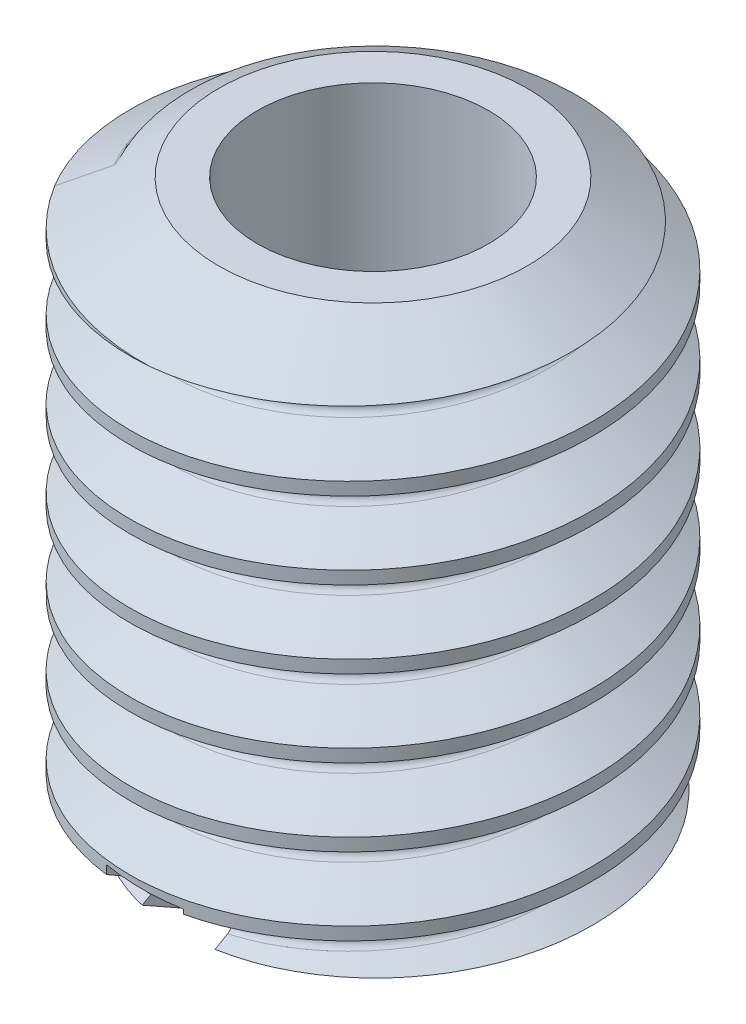
from build123d import *

# Parameters (mm, degrees)
SKETCH1_R           = 3
BOSS_EXTRUDE1_DEPTH = 7.5
CUT_SWEEP1_PITCH    = 1
SKETCH5_R           = 1.5
CUT_EXTRUDE2_DEPTH  = 9.616844126
SKETCH6_W           = 1
SKETCH6_H           = 6
CUT_EXTRUDE4_DEPTH  = 1


with BuildPart() as part:
    # Sketch1 → Boss-Extrude1 (new body)
    with BuildSketch(Plane(origin=(0, 0, 0), x_dir=(1, 0, 0), z_dir=(0, 1, 0))):
        with Locations(Location((0, 0, 0), (0, 0, 270))):
            Circle(SKETCH1_R)
    extrude(amount=BOSS_EXTRUDE1_DEPTH)

    # Cut-Sweep1: the profile of Sketch3 profile screwed along a right-hand helix of 9 turns, 8 arcs to a turn; built about Z, then put on its axis
    cut_sweep1_z = Axis((0, 0, 0), (0, 0, 1))
    cut_sweep1_corners = [(2.440626588, 0, -0.09375), (3.0003, 0, -0.416877595), (3.0003, 0, 0.416877595), (2.440626588, 0, 0.09375), (2.3865, 0, 0)]
    with BuildLine(mode=Mode.PRIVATE) as cut_sweep1_profile:
        Line(cut_sweep1_corners[0], cut_sweep1_corners[1])
        Line(cut_sweep1_corners[1], cut_sweep1_corners[2])
        Line(cut_sweep1_corners[2], cut_sweep1_corners[3])
        ThreePointArc((2.440626588, 0, 0.09375), (2.401003175, 0, 0.054126588), (2.3865, 0, 0))
        ThreePointArc((2.3865, 0, 0), (2.401003175, 0, -0.054126588), (2.440626588, 0, -0.09375))
    cut_sweep1_cap = Face(cut_sweep1_profile.wire())
    cut_sweep1_arcs = [((2.440626588, 0, 0.09375), (2.3865, 0, 0.0625), (2.3865, 0, 0), (1, 0.8660254037844376, 1)), ((2.3865, 0, 0), (2.3865, 0, -0.0625), (2.440626588, 0, -0.09375), (1, 0.8660254037844376, 1))]  # start, shoulder, end, weights
    cut_sweep1_turn_angles = [0, 22.5, 45, 67.5, 90, 112.5, 135, 157.5, 180, 202.5, 225, 247.5, 270, 292.5, 315, 337.5, 360]
    cut_sweep1_turn_weights = [1, 0.9238795325112867, 1, 0.9238795325112867, 1, 0.9238795325112867, 1, 0.9238795325112867, 1, 0.9238795325112867, 1, 0.9238795325112867, 1, 0.9238795325112867, 1, 0.9238795325112867, 1]
    cut_sweep1_turn_rails = [Edge.make_bspline([Vector(p[0], p[1], 0).rotate(cut_sweep1_z, cut_sweep1_turn_angles[k]) / cut_sweep1_turn_weights[k] + Vector(0, 0, p[2] + CUT_SWEEP1_PITCH * cut_sweep1_turn_angles[k] / 360) for k in range(17)], [0, 0, 0, 1, 1, 2, 2, 3, 3, 4, 4, 5, 5, 6, 6, 7, 7, 8, 8, 8], 2, cut_sweep1_turn_weights) for p in cut_sweep1_corners]
    cut_sweep1_turn_sides = [*[Face.make_surface_from_curves(cut_sweep1_turn_rails[p[0]], cut_sweep1_turn_rails[p[1]]) for p in [(0, 1), (1, 2), (2, 3)]], *[Face.make_bezier_surface([[Vector(p[j][0], p[j][1], 0).rotate(cut_sweep1_z, cut_sweep1_turn_angles[2 * i + k]) / cut_sweep1_turn_weights[2 * i + k] + Vector(0, 0, p[j][2] + CUT_SWEEP1_PITCH * cut_sweep1_turn_angles[2 * i + k] / 360) for k in range(3)] for j in range(3)], [[p[3][j] * cut_sweep1_turn_weights[2 * i + k] for k in range(3)] for j in range(3)]) for p in cut_sweep1_arcs for i in range(8)]]
    cut_sweep1 = Plane(origin=(0, 8.5, 0), x_dir=(0, 0, 1), z_dir=(0, -1, 0)) * Solid(Shell([*[p.moved(Location((0, 0, CUT_SWEEP1_PITCH * i))) for i in range(9) for p in cut_sweep1_turn_sides], cut_sweep1_cap, cut_sweep1_cap.rotate(cut_sweep1_z, 3240).moved(Location((0, 0, CUT_SWEEP1_PITCH * 3240 / 360)))]))
    add(cut_sweep1, mode=Mode.SUBTRACT)

    # Sketch4 → Cut-Revolve1 (revolve, cut)
    with BuildSketch(Plane(origin=(0, 0, 0), x_dir=(0, 0, -1), z_dir=(1, 0, 0)), mode=Mode.PRIVATE) as cut_revolve1_sk:
        Polygon((-3, 7.5), (-2, 7.5), (-3, 6.922649731), align=None)
        Polygon((-2, 0), (-3, 0), (-3, 0.577350269), align=None)
    revolve(cut_revolve1_sk.sketch.rotate(Axis((0, 0, 0), (0, 1, 0)), 180), axis=Axis((0, 0, 0), (0, 1, 0)), mode=Mode.SUBTRACT)

    # Sketch5 → Cut-Extrude2 (cut, through all)
    with BuildSketch(Plane(origin=(0, 0, 0), x_dir=(1, 0, 0), z_dir=(0, 1, 0))):
        with Locations(Location((0, 0, 0), (0, 0, 270))):
            Circle(SKETCH5_R)
    extrude(amount=CUT_EXTRUDE2_DEPTH, mode=Mode.SUBTRACT)

    # Sketch6 → Cut-Extrude4 (cut)
    with BuildSketch(Plane(origin=(0, 0, 0), x_dir=(1, 0, 0), z_dir=(0, 1, 0))):
        Rectangle(SKETCH6_W, SKETCH6_H)
    extrude(amount=CUT_EXTRUDE4_DEPTH, mode=Mode.SUBTRACT)


solid = part.part
